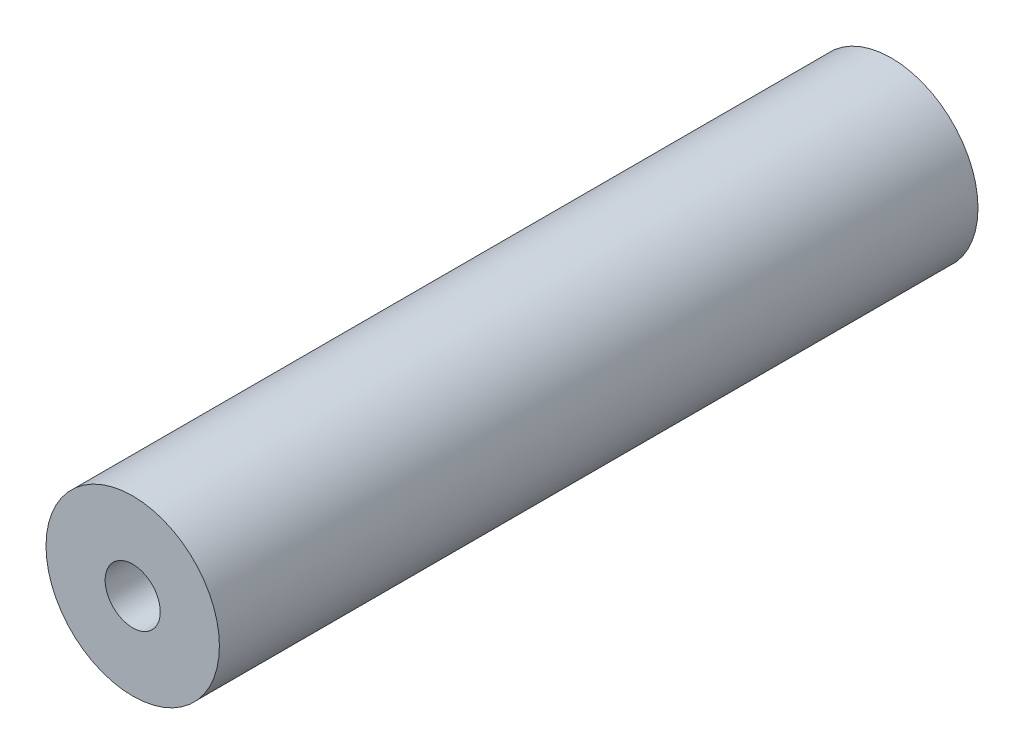
from build123d import *

# Parameters (mm, degrees)
SKETCH1_R           = 6.35
SKETCH1_R_2         = 2.0193
BOSS_EXTRUDE1_DEPTH = 27.78125


with BuildPart() as part:
    # Sketch1 → Boss-Extrude1 (new, symmetric)
    with BuildSketch(Plane.XY):
        Circle(SKETCH1_R)
        Circle(SKETCH1_R_2, mode=Mode.SUBTRACT)
    extrude(amount=BOSS_EXTRUDE1_DEPTH, both=True)


solid = part.part
